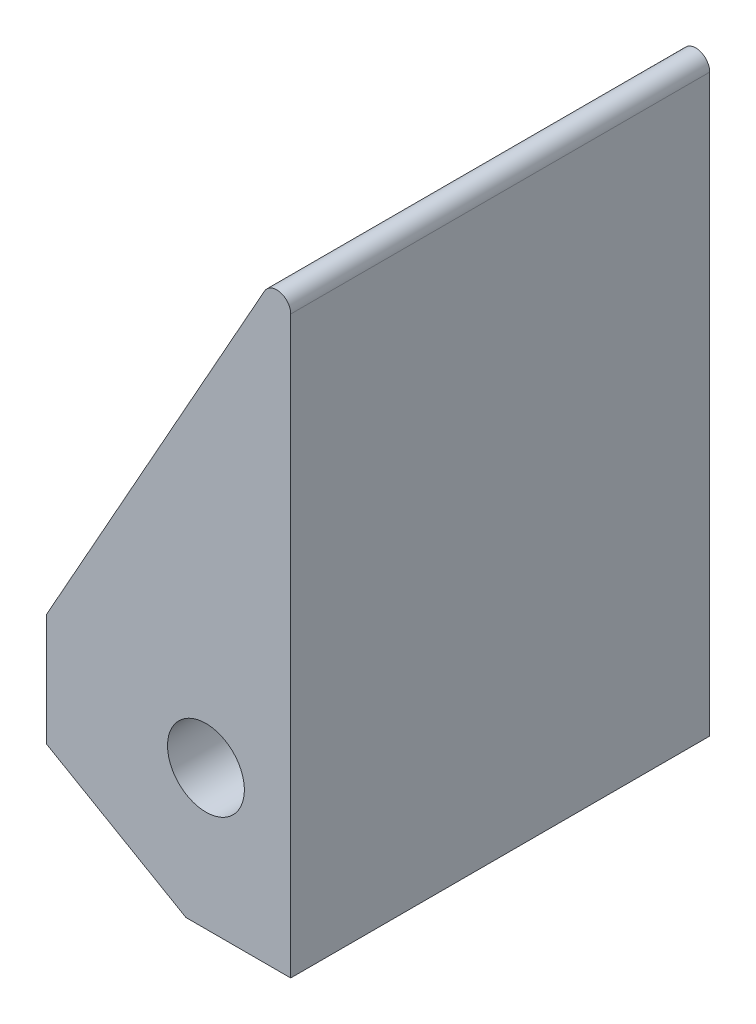
from build123d import *

# Parameters (mm, degrees)
BOSS_EXTRUDE1_DEPTH                = 30
SKETCH2_R                          = 2.75
CUT_EXTRUDE1_DEPTH                 = 40.565786753
SKETCH2_3_R                        = 2
CUT_EXTRUDE2_DEPTH                 = 11
M2_5X0_45_TAPPED_HOLE1_D           = 2.05
M2_5X0_45_TAPPED_HOLE1_DEPTH       = 7.5
M2_5X0_45_TAPPED_HOLE1_CSINK_D     = 2.55
M2_5X0_45_TAPPED_HOLE1_CSINK_ANGLE = 90
M2_5X0_45_TAPPED_HOLE1_TIP         = 0.615882135
FILLET1_R                          = 1


with BuildPart() as part:
    # Sketch1 → Boss-Extrude1 (new body)
    with BuildSketch(Plane.XY):
        Polygon((-8.150210739, -18.26881255), (1.849789261, -24.042315242), (9.349789261, -24.042315242), (9.349789261, 20.957684758), (-8.150210739, -10.26881255), align=None)
    extrude(amount=BOSS_EXTRUDE1_DEPTH)

    # Sketch2 → Cut-Extrude1 (cut, through all)
    with BuildSketch(Plane(origin=(0, 0, 0), x_dir=(-1, 0, 0), z_dir=(0, 0, -1))):
        with Locations((-3.279789261, -14.042315242)):
            Circle(SKETCH2_R)
    extrude(amount=-CUT_EXTRUDE1_DEPTH, mode=Mode.SUBTRACT)

    # Sketch2<3> → Cut-Extrude2 (cut)
    with BuildSketch(Plane(origin=(0, 0, 0), x_dir=(-1, 0, 0), z_dir=(0, 0, -1))):
        with Locations((-3.279789261, -20.392315242)):
            Circle(SKETCH2_3_R)
    extrude(amount=-CUT_EXTRUDE2_DEPTH, mode=Mode.SUBTRACT)

    # M2.5x0.45 Tapped Hole1
    with Locations(Plane(origin=(0, -24.042315242, 0), x_dir=(-1, 0, 0), z_dir=(0, -1, 0))):
        with Locations((-5.599789261, -16)):
            CounterSinkHole(M2_5X0_45_TAPPED_HOLE1_D / 2, M2_5X0_45_TAPPED_HOLE1_CSINK_D / 2, depth=M2_5X0_45_TAPPED_HOLE1_DEPTH, counter_sink_angle=M2_5X0_45_TAPPED_HOLE1_CSINK_ANGLE)
            with Locations((0, 0, -(M2_5X0_45_TAPPED_HOLE1_DEPTH + M2_5X0_45_TAPPED_HOLE1_TIP / 2))):  # 118° drill point
                Cone(0, M2_5X0_45_TAPPED_HOLE1_D / 2, M2_5X0_45_TAPPED_HOLE1_TIP, mode=Mode.SUBTRACT)

    # Fillet1
    fillet1_edges = [part.edges().sort_by_distance(p)[0] for p in [
        (9.349789261, 20.957684758, 15),
    ]]
    fillet(fillet1_edges, radius=FILLET1_R)


solid = part.part
